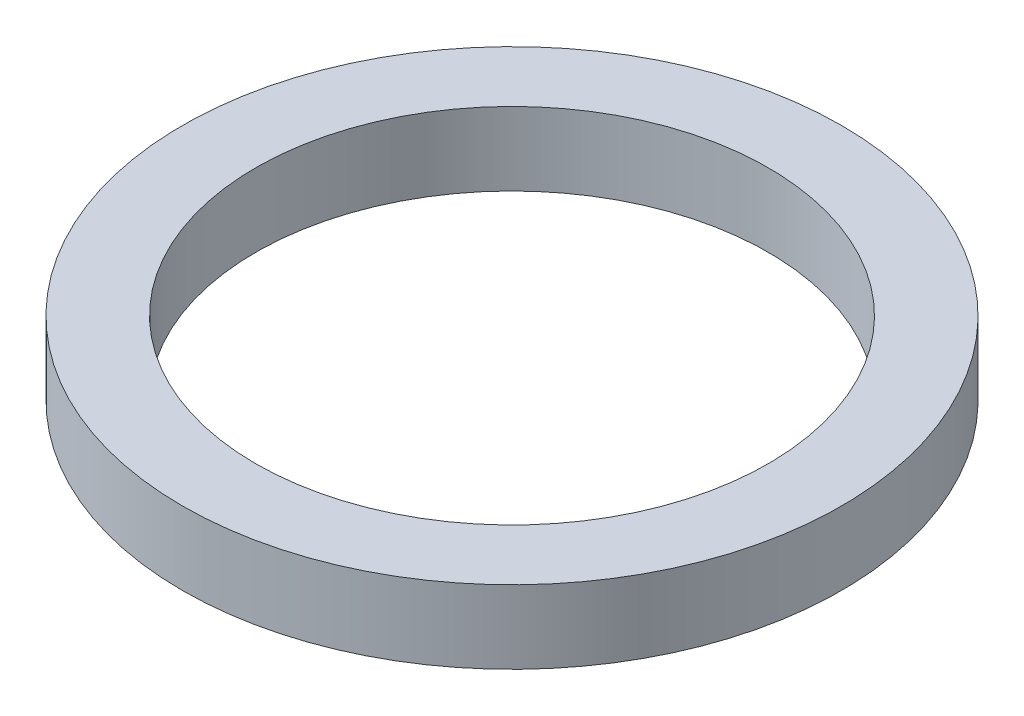
from build123d import *

# Parameters (mm, degrees)
SKETCH1_R           = 45
SKETCH1_R_2         = 35
BOSS_EXTRUDE1_DEPTH = 5


with BuildPart() as part:
    # Sketch1 → Boss-Extrude1 (new, symmetric)
    with BuildSketch(Plane(origin=(0, 0, 0), x_dir=(1, 0, 0), z_dir=(0, 1, 0))):
        Circle(SKETCH1_R)
        Circle(SKETCH1_R_2, mode=Mode.SUBTRACT)
    extrude(amount=BOSS_EXTRUDE1_DEPTH, both=True)


solid = part.part
